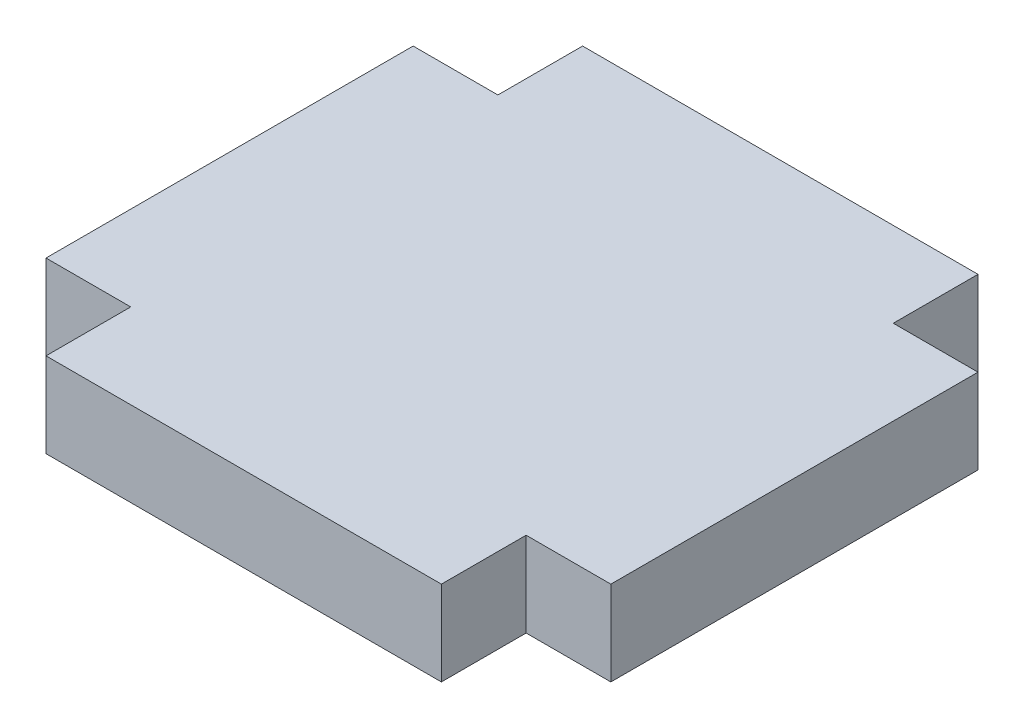
from build123d import *

# Parameters (mm, degrees)
SALIENTE_EXTRUIR1_DEPTH = 3


with BuildPart() as part:
    # Croquis1 → Saliente-Extruir1 (new body)
    with BuildSketch(Plane(origin=(0, 0, 0), x_dir=(1, 0, 0), z_dir=(0, 1, 0))):
        Polygon((0, 0), (0, 13), (3, 13), (3, 16), (17, 16), (17, 13), (20, 13), (20, 0), (17, 0), (17, -3), (3, -3), (3, 0), align=None)
    extrude(amount=SALIENTE_EXTRUIR1_DEPTH)


solid = part.part
